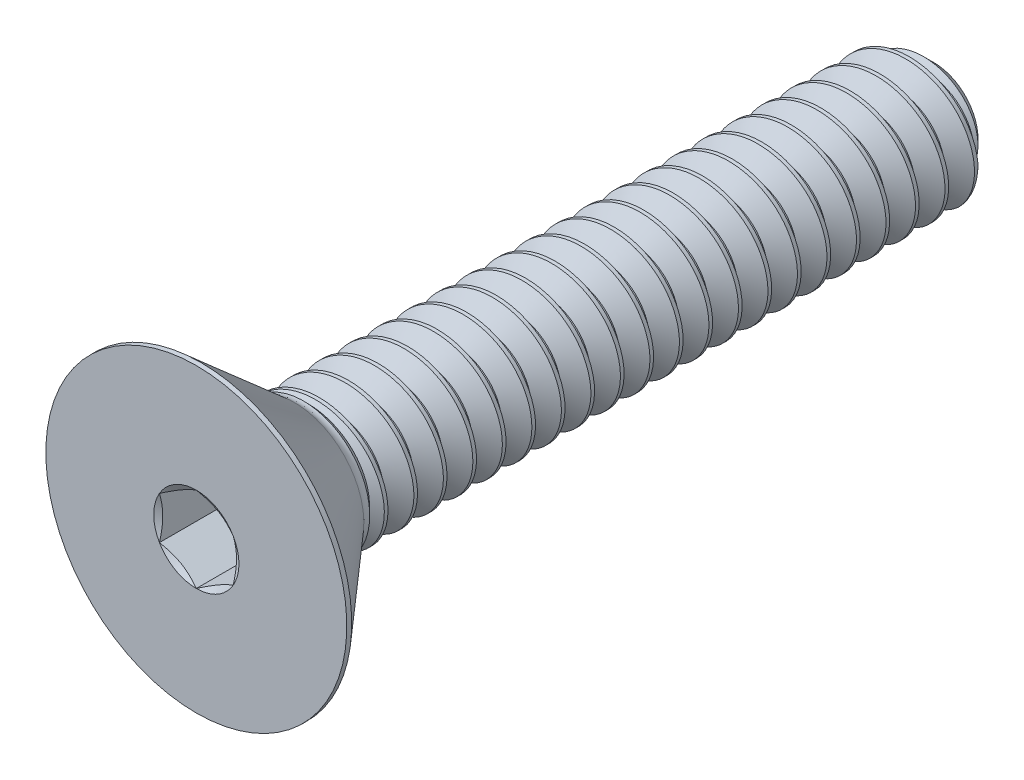
from build123d import *

# Parameters (mm, degrees)
SKETCH1_W          = 15.875
SKETCH1_H          = 1.4224
CHAMFER1_SIZE      = 0.47625
CUT_SWEEP1_PITCH   = 0.635
CUT_EXTRUDE2_DEPTH = 1.47574


with BuildPart() as part:
    # Sketch1 → Revolve1 (revolve)
    with BuildSketch(Plane(origin=(0, 0, 0), x_dir=(0, 0, -1), z_dir=(1, 0, 0))):
        with Locations((7.9375, 0.7112)):
            Rectangle(SKETCH1_W, SKETCH1_H)
    revolve(axis=Axis((0, 0, -15.875), (0, 0, 1)))

    # Chamfer1
    chamfer1_edges = [part.edges().sort_by_distance(p)[0] for p in [
        (0, -1.4224, -15.875),
    ]]
    chamfer(chamfer1_edges, length=CHAMFER1_SIZE)

    # Cut-Sweep1: the profile of Sketch2 profile screwed along a right-hand helix of 25 turns, 6 arcs to a turn; built about Z, then put on its axis
    cut_sweep1_z = Axis((0, 0, 0), (0, 0, 1))
    cut_sweep1_corners = [(1.4227, 0, 0.000173205), (1.4227, 0, -0.555798205), (1.009955401, 0, -0.3175), (1.009955401, 0, -0.238125)]
    with BuildLine(mode=Mode.PRIVATE) as cut_sweep1_profile:
        Line(cut_sweep1_corners[0], cut_sweep1_corners[1])
        Line(cut_sweep1_corners[1], cut_sweep1_corners[2])
        Line(cut_sweep1_corners[2], cut_sweep1_corners[3])
        Line(cut_sweep1_corners[3], cut_sweep1_corners[0])
    cut_sweep1_cap = Face(cut_sweep1_profile.wire())
    cut_sweep1_turn_angles = [0, 30, 60, 90, 120, 150, 180, 210, 240, 270, 300, 330, 360]
    cut_sweep1_turn_weights = [1, 0.8660254037844387, 1, 0.8660254037844387, 1, 0.8660254037844387, 1, 0.8660254037844387, 1, 0.8660254037844387, 1, 0.8660254037844387, 1]
    cut_sweep1_turn_rails = [Edge.make_bspline([Vector(p[0], p[1], 0).rotate(cut_sweep1_z, cut_sweep1_turn_angles[k]) / cut_sweep1_turn_weights[k] + Vector(0, 0, p[2] + CUT_SWEEP1_PITCH * cut_sweep1_turn_angles[k] / 360) for k in range(13)], [0, 0, 0, 1, 1, 2, 2, 3, 3, 4, 4, 5, 5, 6, 6, 6], 2, cut_sweep1_turn_weights) for p in cut_sweep1_corners]
    cut_sweep1_turn_sides = [Face.make_surface_from_curves(cut_sweep1_turn_rails[p[0]], cut_sweep1_turn_rails[p[1]]) for p in [(0, 1), (1, 2), (2, 3), (3, 0)]]
    cut_sweep1 = Plane(origin=(0, 0, -15.875), x_dir=(0, 1, 0), z_dir=(0, 0, 1)) * Solid(Shell([*[p.moved(Location((0, 0, CUT_SWEEP1_PITCH * i))) for i in range(25) for p in cut_sweep1_turn_sides], cut_sweep1_cap, cut_sweep1_cap.rotate(cut_sweep1_z, 9000).moved(Location((0, 0, CUT_SWEEP1_PITCH * 9000 / 360)))]))
    add(cut_sweep1, mode=Mode.SUBTRACT)

    # Sketch7 → Revolve2 (revolve)
    with BuildSketch(Plane(origin=(0, 0, 0), x_dir=(0, 0, -1), z_dir=(1, 0, 0)), mode=Mode.PRIVATE) as revolve2_sk:
        with BuildLine():
            Line((0, 3.2385), (0.10541, 3.2385))
            Line((0.10541, 3.2385), (2.1082, 1.497501214))
            ThreePointArc((2.1082, 1.497501214), (2.201843405, 1.441789243), (2.309067322, 1.4224))
            Line((2.309067322, 1.4224), (2.309067322, 0))
            Line((2.309067322, 0), (0, 0))
            Line((0, 0), (0, 3.2385))
        make_face()
    revolve(revolve2_sk.sketch.rotate(Axis((0, 0, 0), (0, 0, -1)), 189.336081704), axis=Axis((0, 0, 0), (0, 0, -1)))

    # Boss-Extrude1 cone 1 section (through the dimple's axis) → Boss-Extrude1 (revolve)
    with BuildSketch(Plane(origin=(0, 0, -2.309067322), x_dir=(0, -1, 0), z_dir=(1, 0, 0))):
        Polygon((0, 0), (1.4224, 0), (0, 1.373595713), align=None)
    revolve(axis=Axis((0, 0, -2.309067322), (0, 0, -1)))

    # Sketch5 → Cut-Extrude2 (cut)
    with BuildSketch(Plane.XY):
        Polygon((0, 0.916543552), (-0.79375, 0.458271776), (-0.79375, -0.458271776), (0, -0.916543552), (0.79375, -0.458271776), (0.79375, 0.458271776), align=None)
    extrude(amount=-CUT_EXTRUDE2_DEPTH, mode=Mode.SUBTRACT)

    # Cut-Extrude3 cone 1 section (through the dimple's axis) → Cut-Extrude3 (revolve, cut)
    with BuildSketch(Plane(origin=(0, 0, 0), x_dir=(0, -1, 0), z_dir=(1, 0, 0))):
        Polygon((0, 0), (0.916543552, 0), (0, 0.529166667), align=None)
    revolve(axis=Axis((0, 0, 0), (0, 0, -1)), mode=Mode.SUBTRACT)


solid = part.part
